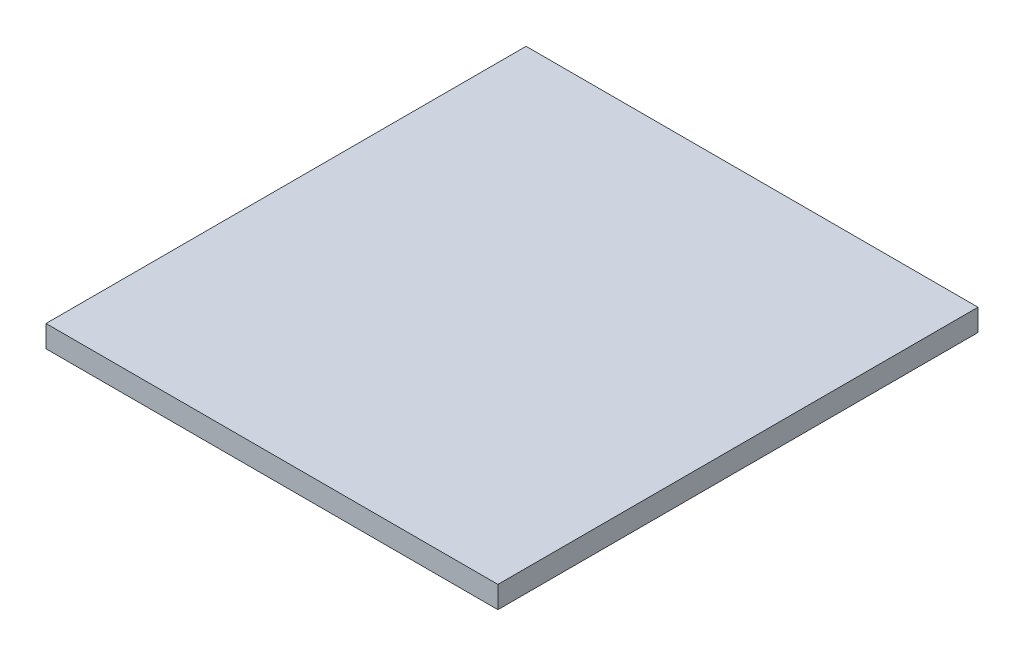
from build123d import *

# Parameters (mm, degrees)
SKETCH1_W           = 109.982
SKETCH1_H           = 116.84
BOSS_EXTRUDE1_DEPTH = 2.667


with BuildPart() as part:
    # Sketch1 → Boss-Extrude1 (new, symmetric)
    with BuildSketch(Plane(origin=(0, 0, 0), x_dir=(1, 0, 0), z_dir=(0, 1, 0))):
        Rectangle(SKETCH1_W, SKETCH1_H)
    extrude(amount=BOSS_EXTRUDE1_DEPTH, both=True)


solid = part.part
